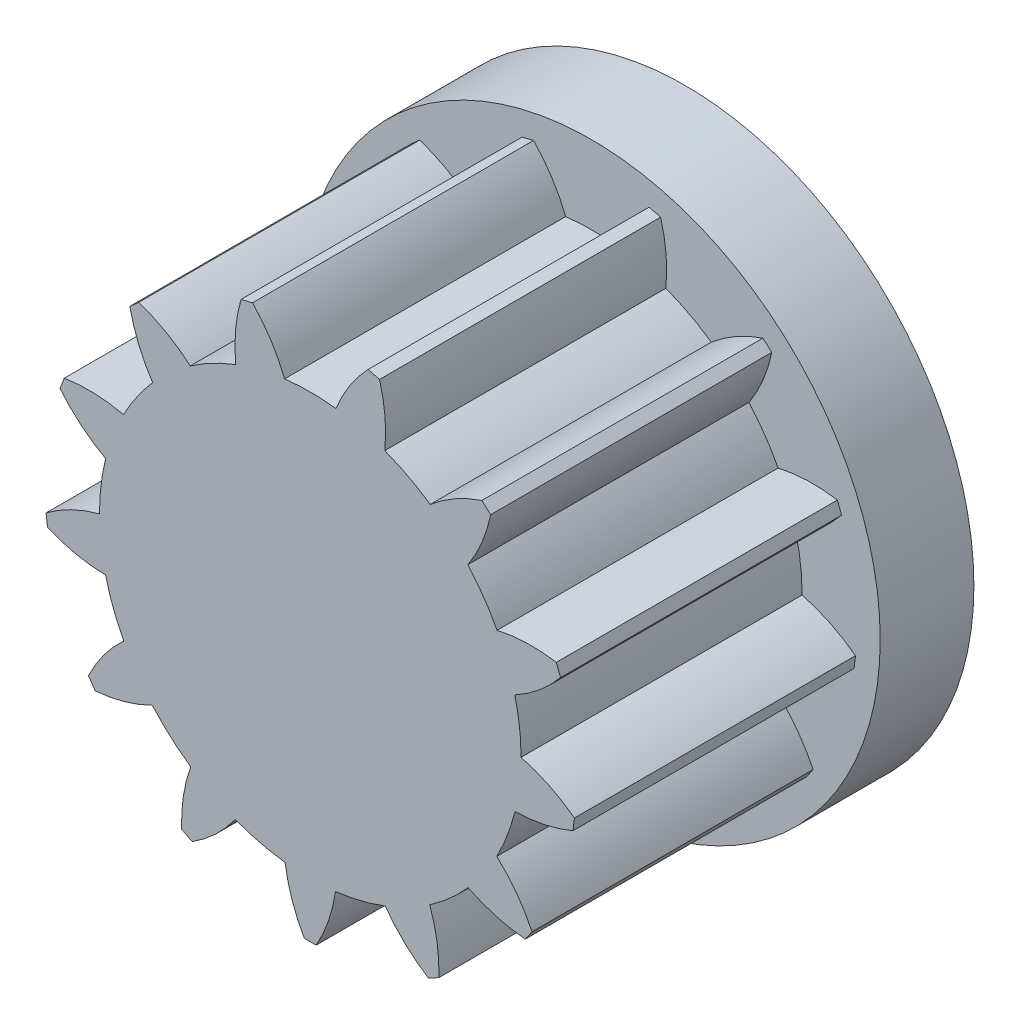
from build123d import *

# Parameters (mm, degrees)
SKETCH1_R           = 9.25
BOSS_EXTRUDE1_DEPTH = 3
BOSS_EXTRUDE2_DEPTH = 9


with BuildPart() as part:
    # Sketch1 → Boss-Extrude1 (new body)
    with BuildSketch(Plane.XY):
        Circle(SKETCH1_R)
    extrude(amount=BOSS_EXTRUDE1_DEPTH)

    # Sketch2 → Boss-Extrude2 (add)
    with BuildSketch(Plane.XY.offset(3)):
        with BuildLine():
            Line((-0.190570445, -8.497863432), (0, -8.497876224))
            Line((0, -8.497876224), (0.189429554, -8.49788894))
            ThreePointArc((0.189429554, -8.49788894), (0.583707123, -7.629584676), (0.804550118, -6.701880267))
            ThreePointArc((0.804550118, -6.701880267), (1.614940783, -6.55396569), (2.401278382, -6.308435791))
            ThreePointArc((2.401278382, -6.308435791), (3.027854368, -7.027330521), (3.7804123, -7.613046883))
            Line((3.7804123, -7.613046883), (4.116897444, -7.436474665))
            ThreePointArc((4.116897444, -7.436474665), (4.062491781, -6.484399498), (3.826912806, -5.560327183))
            ThreePointArc((3.826912806, -5.560327183), (4.475738772, -5.052748009), (5.057902704, -4.469912777))
            ThreePointArc((5.057902704, -4.469912777), (5.946795225, -4.815278068), (6.885348147, -4.98417304))
            Line((6.885348147, -4.98417304), (7.101233744, -4.671453662))
            ThreePointArc((7.101233744, -4.671453662), (6.610608531, -3.853716541), (5.972575889, -3.14497015))
            ThreePointArc((5.972575889, -3.14497015), (6.311198947, -2.394006651), (6.555822471, -1.607386614))
            ThreePointArc((6.555822471, -1.607386614), (7.503396964, -1.50010344), (8.412933711, -1.21348522))
            Line((8.412933711, -1.21348522), (8.458762972, -0.836258923))
            ThreePointArc((8.458762972, -0.836258923), (7.644314532, -0.340193567), (6.749993814, -0.009138357))
            ThreePointArc((6.749993814, -0.009138357), (6.700839502, 0.813172779), (6.551882316, 1.623372451))
            ThreePointArc((6.551882316, 1.623372451), (7.341060883, 2.158726808), (8.013217548, 2.83519744))
            Line((8.013217548, 2.83519744), (7.878491542, 3.190512657))
            ThreePointArc((7.878491542, 3.190512657), (6.926800198, 3.251263653), (5.981069502, 3.128786923))
            ThreePointArc((5.981069502, 3.128786923), (5.555398481, 3.834064126), (5.046984881, 4.482236452))
            ThreePointArc((5.046984881, 4.482236452), (5.496976224, 5.32301876), (5.777769815, 6.234370535))
            Line((5.777769815, 6.234370535), (5.493352647, 6.486376238))
            ThreePointArc((5.493352647, 6.486376238), (4.622439416, 6.097895553), (3.841954247, 5.549944825))
            ThreePointArc((3.841954247, 5.549944825), (3.137282617, 5.976617587), (2.385884033, 6.314274098))
            ThreePointArc((2.385884033, 6.314274098), (2.393600558, 7.267871263), (2.218704647, 8.205324472))
            Line((2.218704647, 8.205324472), (1.849752862, 8.296289192))
            ThreePointArc((1.849752862, 8.296289192), (1.25913347, 7.547573069), (0.822693575, 6.699677252))
            ThreePointArc((0.822693575, 6.699677252), (0.412115608, 6.737407567), (0, 6.75))
            ThreePointArc((0, 6.75), (-0.411663338, 6.737435216), (-0.821794095, 6.699787643))
            ThreePointArc((-0.821794095, 6.699787643), (-1.258120151, 7.547742047), (-1.848639018, 8.296537457))
            Line((-1.848639018, 8.296537457), (-2.217603012, 8.205622273))
            ThreePointArc((-2.217603012, 8.205622273), (-2.39262478, 7.268192553), (-2.385036281, 6.31459436))
            ThreePointArc((-2.385036281, 6.31459436), (-3.136480191, 5.977038732), (-3.841209099, 5.550460581))
            ThreePointArc((-3.841209099, 5.550460581), (-4.621620694, 6.098516089), (-5.492481762, 6.487113696))
            Line((-5.492481762, 6.487113696), (-5.776932761, 6.235146179))
            ThreePointArc((-5.776932761, 6.235146179), (-5.496261527, 5.323756714), (-5.046383068, 4.482914))
            ThreePointArc((-5.046383068, 4.482914), (-5.554883684, 3.834809938), (-5.98064939, 3.12958989))
            ThreePointArc((-5.98064939, 3.12958989), (-6.926363634, 3.252193589), (-7.878063126, 3.191570364))
            Line((-7.878063126, 3.191570364), (-8.012836833, 2.836273238))
            ThreePointArc((-8.012836833, 2.836273238), (-7.340770995, 2.159712371), (-6.551664309, 1.624252067))
            ThreePointArc((-6.551664309, 1.624252067), (-6.700730268, 0.814072401), (-6.74999498, -0.008232129))
            ThreePointArc((-6.74999498, -0.008232129), (-7.644360136, -0.339167268), (-8.458875168, -0.835123275))
            Line((-8.458875168, -0.835123275), (-8.413096553, -1.212355721))
            ThreePointArc((-8.413096553, -1.212355721), (-7.503598294, -1.49909605), (-6.556038214, -1.60650644))
            ThreePointArc((-6.556038214, -1.60650644), (-6.3115203, -2.393159313), (-5.972998067, -3.144168267))
            ThreePointArc((-5.972998067, -3.144168267), (-6.611125856, -3.852828992), (-7.101860851, -4.670500236))
            Line((-7.101860851, -4.670500236), (-6.886017241, -4.983248595))
            ThreePointArc((-6.886017241, -4.983248595), (-5.947441652, -4.814479631), (-5.058502772, -4.469233682))
            ThreePointArc((-5.058502772, -4.469233682), (-4.476417094, -5.052147068), (-3.827659279, -5.559813346))
            ThreePointArc((-3.827659279, -5.559813346), (-4.063362315, -6.483854026), (-4.117895799, -7.435921879))
            Line((-4.117895799, -7.435921879), (-3.781434364, -7.612539271))
            ThreePointArc((-3.781434364, -7.612539271), (-3.028797802, -7.02692395), (-2.402125307, -6.308113348))
            ThreePointArc((-2.402125307, -6.308113348), (-1.615820678, -6.553748816), (-0.805449879, -6.70177219))
            ThreePointArc((-0.805449879, -6.70177219), (-0.584731436, -7.629506241), (-0.190570445, -8.497863432))
        make_face()
    extrude(amount=BOSS_EXTRUDE2_DEPTH)


solid = part.part
